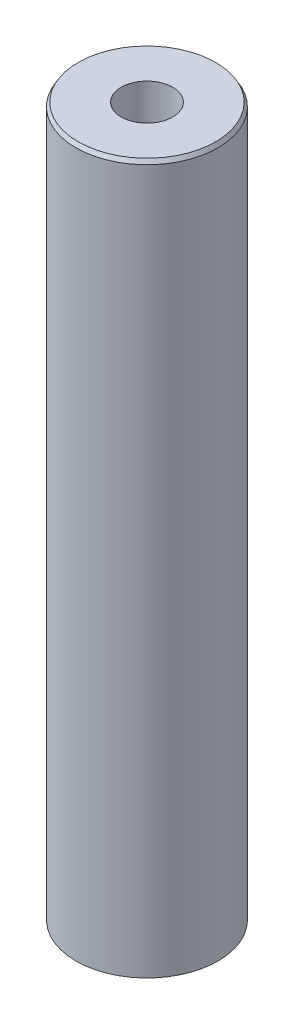
from build123d import *
from OCP.BRepFilletAPI import BRepFilletAPI_MakeChamfer

# Parameters (mm, degrees)
SKETCH1_R           = 60
BOSS_EXTRUDE1_DEPTH = 600
SKETCH2_R           = 21.758261297
CUT_EXTRUDE1_DEPTH  = 606.970296302
CHAMFER1_SIZE       = 3.387360559
CHAMFER1_SIZE2      = 1.955693531


with BuildPart() as part:
    # Sketch1 → Boss-Extrude1 (new body)
    with BuildSketch(Plane(origin=(0, 0, 0), x_dir=(1, 0, 0), z_dir=(0, 1, 0))):
        Circle(SKETCH1_R)
    extrude(amount=BOSS_EXTRUDE1_DEPTH)

    # Sketch2 → Cut-Extrude1 (cut, through all)
    with BuildSketch(Plane(origin=(0, 0, 0), x_dir=(1, 0, 0), z_dir=(0, 1, 0))):
        Circle(SKETCH2_R)
    extrude(amount=CUT_EXTRUDE1_DEPTH, mode=Mode.SUBTRACT)

    # Chamfer1: one chamfer whose edges measure the first distance from different faces: ONE call of the kernel's chamfer builder (chamfer() names one face for all edges)
    chamfer1_edges_1 = [part.edges().sort_by_distance(p)[0] for p in [
        (-60, 600, 0),
    ]]
    chamfer1_side_1 = [part.faces().sort_by_distance(p)[0] for p in [
        (-60, 300, 0),
    ]]
    chamfer1_edges_2 = [part.edges().sort_by_distance(p)[0] for p in [
        (-60, 0, 0),
    ]]
    chamfer1_side_2 = [part.faces().sort_by_distance(p)[0] for p in [
        (-58.302943725, 0, 0),
    ]]
    chamfer1 = BRepFilletAPI_MakeChamfer(part.part.solid().wrapped)
    for e in chamfer1_edges_1:
        chamfer1.Add(CHAMFER1_SIZE, CHAMFER1_SIZE2, e.wrapped, chamfer1_side_1[0].wrapped)  # the first distance lies on this face
    for e in chamfer1_edges_2:
        chamfer1.Add(CHAMFER1_SIZE, CHAMFER1_SIZE2, e.wrapped, chamfer1_side_2[0].wrapped)  # the first distance lies on this face
    add(Compound.cast(chamfer1.Shape()), mode=Mode.REPLACE)


solid = part.part
